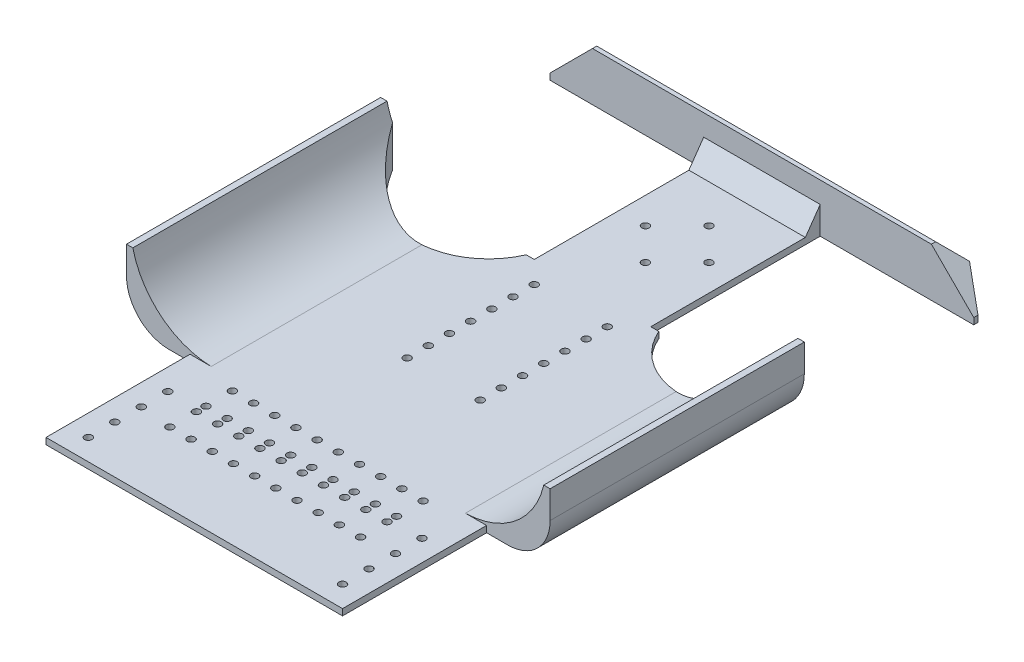
from build123d import *

# Parameters (mm, degrees)
BOSS_EXTRUDE1_DEPTH       = 3
BOSS_EXTRUDE2_DEPTH       = 20
CHAMFER1_SIZE             = 20
SKETCH9_R                 = 1.75
CUT_EXTRUDE6_DEPTH        = 192.426225998
CHAMFER2_SIZE             = 10
CHAMFER2_SIZE2            = 7.002075382
SKETCH12_W                = 40
SKETCH12_H                = 120
BOSS_EXTRUDE3_DEPTH       = 30
CUT_EXTRUDE8_DEPTH        = 120
CUT_EXTRUDE9_DEPTH        = 194.217494032
FILLET2_R                 = 20
SKETCH16_R                = 1.75
CUT_EXTRUDE10_DEPTH       = 193.727787374
LPATTERN1_COUNT           = 7
LPATTERN1_PITCH           = 10
SKETCH17_R                = 1.75
CUT_EXTRUDE11_DEPTH       = 193.727787374
LPATTERN2_COUNT           = 2
LPATTERN2_PITCH           = 12.5
MIRROR4_COPY_1_SKETCH_R   = 1.75
MIRROR4_COPY_1_DEPTH      = 193.727787374
SKETCH18_R                = 1.75
CUT_EXTRUDE12_DEPTH       = 193.727787374
LPATTERN3_COUNT           = 10
LPATTERN3_PITCH           = 10
LPATTERN4_COUNT           = 2
LPATTERN4_PITCH           = 12.5
LPATTERN4_COPY_1_SKETCH_R = 1.75
LPATTERN4_COPY_1_DEPTH    = 193.727787374
LPATTERN4_COPY_2_SKETCH_R = 1.75
LPATTERN4_COPY_2_DEPTH    = 193.727787374
LPATTERN4_COPY_3_SKETCH_R = 1.75
LPATTERN4_COPY_3_DEPTH    = 193.727787374
LPATTERN4_COPY_4_SKETCH_R = 1.75
LPATTERN4_COPY_4_DEPTH    = 193.727787374
LPATTERN4_COPY_5_SKETCH_R = 1.75
LPATTERN4_COPY_5_DEPTH    = 193.727787374
LPATTERN4_COPY_6_SKETCH_R = 1.75
LPATTERN4_COPY_6_DEPTH    = 193.727787374
LPATTERN4_COPY_7_SKETCH_R = 1.75
LPATTERN4_COPY_7_DEPTH    = 193.727787374
LPATTERN4_COPY_8_SKETCH_R = 1.75
LPATTERN4_COPY_8_DEPTH    = 193.727787374
LPATTERN4_COPY_9_SKETCH_R = 1.75
LPATTERN4_COPY_9_DEPTH    = 193.727787374


with BuildPart() as part:
    # Sketch1 → Boss-Extrude1 (new body)
    with BuildSketch(Plane(origin=(0, 0, 0), x_dir=(1, 0, 0), z_dir=(0, 1, 0))):
        Polygon((100, 60), (100, -60), (70, -60), (70, -128), (-70, -128), (-70, -60), (-100, -60), (-100, 60), (-27.5, 60), (-27.5, 140), (-100, 140), (-100, 142), (-70, 162), (70, 162), (100, 142), (100, 140), (27.5, 140), (27.5, 60), align=None)
    extrude(amount=BOSS_EXTRUDE1_DEPTH)

    # Sketch8 → Boss-Extrude2 (add)
    with BuildSketch(Plane(origin=(0, 3, 0), x_dir=(1, 0, 0), z_dir=(0, 1, 0))):
        Polygon((-100, 140), (100, 140), (100, 142), (70, 162), (-70, 162), (-100, 142), align=None)
    extrude(amount=BOSS_EXTRUDE2_DEPTH)

    # Chamfer1
    # the kernel refuses this chamfer: 20 mm, written as the material it takes off along each edge
    with BuildSketch(Plane(origin=(121.433659759, 23, -162), x_dir=(0, -0.9996219169112968, -0.027495876610586317), z_dir=(-1, 0, 0))) as chamfer1_piece_1:
        Polygon((CHAMFER1_SIZE * 0.999621916911, CHAMFER1_SIZE * 0.0274958766106), (-CHAMFER1_SIZE * 0.0274958766106, CHAMFER1_SIZE * 0.999621916911), (0, 0), align=None)
    extrude(amount=242.867319519, mode=Mode.SUBTRACT)
    with BuildSketch(Plane(origin=(-100, 23, -193.433659759), x_dir=(-0.027495876610586317, -0.9996219169112968, 0), z_dir=(0, 0, 1))) as chamfer1_piece_2:
        Polygon((CHAMFER1_SIZE * 0.999621916911, CHAMFER1_SIZE * 0.0274958766106), (-CHAMFER1_SIZE * 0.0274958766106, CHAMFER1_SIZE * 0.999621916911), (0, 0), align=None)
    extrude(amount=104.867319519, mode=Mode.SUBTRACT)
    with BuildSketch(Plane(origin=(100, 23, -88.566340241), x_dir=(-0.9996219169112968, 0.027495876610586317, 0), z_dir=(0, 0, -1))) as chamfer1_piece_3:
        Polygon((CHAMFER1_SIZE * 0.999621916911, -CHAMFER1_SIZE * 0.0274958766106), (-CHAMFER1_SIZE * 0.0274958766106, -CHAMFER1_SIZE * 0.999621916911), (0, 0), align=None)
    extrude(amount=104.867319519, mode=Mode.SUBTRACT)

    # Sketch9 → Cut-Extrude6 (cut, through all)
    with BuildSketch(Plane(origin=(0, 3, 0), x_dir=(1, 0, 0), z_dir=(0, 1, 0))):
        with Locations(Location((-15, 100, 0), (0, 0, 270))):
            Circle(SKETCH9_R)
        with Locations(Location((15, 100, 0), (0, 0, 270))):
            Circle(SKETCH9_R)
        with Locations(Location((0, 115, 0), (0, 0, 270))):
            Circle(SKETCH9_R)
        with Locations(Location((0, 85, 0), (0, 0, 270))):
            Circle(SKETCH9_R)
    extrude(amount=-CUT_EXTRUDE6_DEPTH, mode=Mode.SUBTRACT)

    # Chamfer2
    chamfer2_edges = [part.edges().sort_by_distance(p)[0] for p in [
        (0, 3, -140),
    ]]
    chamfer2_side = [part.faces().sort_by_distance(p)[0] for p in [
        (0, 11.429781082, -140),
    ]]
    chamfer(chamfer2_edges, length=CHAMFER2_SIZE, length2=CHAMFER2_SIZE2, reference=chamfer2_side[0])

    # Sketch12 → Boss-Extrude3 (add)
    with BuildSketch(Plane(origin=(0, 3, 0), x_dir=(1, 0, 0), z_dir=(0, 1, 0))):
        with Locations((-80, 0)):
            Rectangle(SKETCH12_W, SKETCH12_H)
    boss_extrude3 = extrude(amount=BOSS_EXTRUDE3_DEPTH)

    # Sketch13 → Cut-Extrude8 (cut)
    with BuildSketch(Plane.XY.offset(60)):
        with BuildLine():
            Line((-97, 33), (-60, 33))
            Line((-60, 33), (-60, 3))
            ThreePointArc((-60, 3), (-83.63033668, 11.672584761), (-97, 33))
        make_face()
    cut_extrude8 = extrude(amount=-CUT_EXTRUDE8_DEPTH, mode=Mode.SUBTRACT)

    # Sketch14 → Cut-Extrude9 (cut, through all)
    with BuildSketch(Plane.XZ):
        with BuildLine():
            Line((-31.303743975, -60), (-94.382349042, -60))
            ThreePointArc((-94.382349042, -60), (-62.843046509, -39.350555542), (-31.303743975, -60))
        make_face()
    cut_extrude9 = extrude(amount=-CUT_EXTRUDE9_DEPTH, mode=Mode.SUBTRACT)

    # Mirror3: Boss-Extrude3, Cut-Extrude8, Cut-Extrude9 across plane
    add(boss_extrude3.mirror(Plane(origin=(0, 0, 0), x_dir=(0, 0, 1), z_dir=(1, 0, 0))))
    add(cut_extrude8.mirror(Plane(origin=(0, 0, 0), x_dir=(0, 0, 1), z_dir=(1, 0, 0))), mode=Mode.SUBTRACT)
    add(cut_extrude9.mirror(Plane(origin=(0, 0, 0), x_dir=(0, 0, 1), z_dir=(1, 0, 0))), mode=Mode.SUBTRACT)

    # Fillet2
    fillet2_edges = [part.edges().sort_by_distance(p)[0] for p in [
        (-100, 0, 0),
        (100, 0, 0),
    ]]
    fillet(fillet2_edges, radius=FILLET2_R)

    # Sketch16 → Cut-Extrude10 (cut, through all)
    with BuildSketch(Plane(origin=(0, 3, 0), x_dir=(1, 0, 0), z_dir=(0, 1, 0))):
        with Locations(Location((-17.25, 49.727630158, 0), (0, 0, 270))):
            Circle(SKETCH16_R)
        with Locations(Location((17.25, 49.727630158, 0), (0, 0, 270))):
            Circle(SKETCH16_R)
    cut_extrude10 = extrude(amount=-CUT_EXTRUDE10_DEPTH, mode=Mode.SUBTRACT)

    # LPattern1: Cut-Extrude10 ×7
    with Locations(*[(0, 0, i * LPATTERN1_PITCH) for i in range(1, LPATTERN1_COUNT)]):
        add(cut_extrude10, mode=Mode.SUBTRACT)

    # Sketch17 → Cut-Extrude11 (cut, through all)
    with BuildSketch(Plane(origin=(0, 3, 0), x_dir=(1, 0, 0), z_dir=(0, 1, 0))):
        with Locations(Location((-60, -118, 0), (0, 0, 270))):
            Circle(SKETCH17_R)
        with Locations(Location((-60, -93, 0), (0, 0, 270))):
            Circle(SKETCH17_R)
    cut_extrude11 = extrude(amount=-CUT_EXTRUDE11_DEPTH, mode=Mode.SUBTRACT)

    # LPattern2: Cut-Extrude11 ×2
    with Locations(*[(0, 0, -i * LPATTERN2_PITCH) for i in range(1, LPATTERN2_COUNT)]):
        add(cut_extrude11, mode=Mode.SUBTRACT)

    # Mirror4: Cut-Extrude11 across plane
    add(cut_extrude11.mirror(Plane(origin=(0, 0, 0), x_dir=(0, 0, 1), z_dir=(1, 0, 0))), mode=Mode.SUBTRACT)

    # Mirror4 copy 1 sketch → Mirror4 copy 1 (cut, through all)
    with BuildSketch(Plane(origin=(0, 3, -12.5), x_dir=(-1, 0, 0), z_dir=(0, 1, 0))):
        with Locations((-60, 118)):
            Circle(MIRROR4_COPY_1_SKETCH_R)
        with Locations((-60, 93)):
            Circle(MIRROR4_COPY_1_SKETCH_R)
    extrude(amount=-MIRROR4_COPY_1_DEPTH, mode=Mode.SUBTRACT)

    # Sketch18 → Cut-Extrude12 (cut, through all)
    with BuildSketch(Plane(origin=(0, 3, 0), x_dir=(1, 0, 0), z_dir=(0, 1, 0))):
        with Locations(Location((-45, -82, 0), (0, 0, 270))):
            Circle(SKETCH18_R)
        with Locations(Location((-45, -65, 0), (0, 0, 270))):
            Circle(SKETCH18_R)
    cut_extrude12 = extrude(amount=-CUT_EXTRUDE12_DEPTH, mode=Mode.SUBTRACT)

    # LPattern3: Cut-Extrude12 ×10
    with Locations(*[(i * LPATTERN3_PITCH, 0, 0) for i in range(1, LPATTERN3_COUNT)]):
        add(cut_extrude12, mode=Mode.SUBTRACT)

    # LPattern4: Cut-Extrude12 ×2
    with Locations(*[(0, 0, i * LPATTERN4_PITCH) for i in range(1, LPATTERN4_COUNT)]):
        add(cut_extrude12, mode=Mode.SUBTRACT)

    # LPattern4 copy 1 sketch → LPattern4 copy 1 (cut, through all)
    with BuildSketch(Plane(origin=(10, 3, 12.5), x_dir=(1, 0, 0), z_dir=(0, 1, 0))):
        with Locations(Location((-45, -82, 0), (0, 0, 270))):
            Circle(LPATTERN4_COPY_1_SKETCH_R)
        with Locations(Location((-45, -65, 0), (0, 0, 270))):
            Circle(LPATTERN4_COPY_1_SKETCH_R)
    extrude(amount=-LPATTERN4_COPY_1_DEPTH, mode=Mode.SUBTRACT)

    # LPattern4 copy 2 sketch → LPattern4 copy 2 (cut, through all)
    with BuildSketch(Plane(origin=(20, 3, 12.5), x_dir=(1, 0, 0), z_dir=(0, 1, 0))):
        with Locations(Location((-45, -82, 0), (0, 0, 270))):
            Circle(LPATTERN4_COPY_2_SKETCH_R)
        with Locations(Location((-45, -65, 0), (0, 0, 270))):
            Circle(LPATTERN4_COPY_2_SKETCH_R)
    extrude(amount=-LPATTERN4_COPY_2_DEPTH, mode=Mode.SUBTRACT)

    # LPattern4 copy 3 sketch → LPattern4 copy 3 (cut, through all)
    with BuildSketch(Plane(origin=(30, 3, 12.5), x_dir=(1, 0, 0), z_dir=(0, 1, 0))):
        with Locations(Location((-45, -82, 0), (0, 0, 270))):
            Circle(LPATTERN4_COPY_3_SKETCH_R)
        with Locations(Location((-45, -65, 0), (0, 0, 270))):
            Circle(LPATTERN4_COPY_3_SKETCH_R)
    extrude(amount=-LPATTERN4_COPY_3_DEPTH, mode=Mode.SUBTRACT)

    # LPattern4 copy 4 sketch → LPattern4 copy 4 (cut, through all)
    with BuildSketch(Plane(origin=(40, 3, 12.5), x_dir=(1, 0, 0), z_dir=(0, 1, 0))):
        with Locations(Location((-45, -82, 0), (0, 0, 270))):
            Circle(LPATTERN4_COPY_4_SKETCH_R)
        with Locations(Location((-45, -65, 0), (0, 0, 270))):
            Circle(LPATTERN4_COPY_4_SKETCH_R)
    extrude(amount=-LPATTERN4_COPY_4_DEPTH, mode=Mode.SUBTRACT)

    # LPattern4 copy 5 sketch → LPattern4 copy 5 (cut, through all)
    with BuildSketch(Plane(origin=(50, 3, 12.5), x_dir=(1, 0, 0), z_dir=(0, 1, 0))):
        with Locations(Location((-45, -82, 0), (0, 0, 270))):
            Circle(LPATTERN4_COPY_5_SKETCH_R)
        with Locations(Location((-45, -65, 0), (0, 0, 270))):
            Circle(LPATTERN4_COPY_5_SKETCH_R)
    extrude(amount=-LPATTERN4_COPY_5_DEPTH, mode=Mode.SUBTRACT)

    # LPattern4 copy 6 sketch → LPattern4 copy 6 (cut, through all)
    with BuildSketch(Plane(origin=(60, 3, 12.5), x_dir=(1, 0, 0), z_dir=(0, 1, 0))):
        with Locations(Location((-45, -82, 0), (0, 0, 270))):
            Circle(LPATTERN4_COPY_6_SKETCH_R)
        with Locations(Location((-45, -65, 0), (0, 0, 270))):
            Circle(LPATTERN4_COPY_6_SKETCH_R)
    extrude(amount=-LPATTERN4_COPY_6_DEPTH, mode=Mode.SUBTRACT)

    # LPattern4 copy 7 sketch → LPattern4 copy 7 (cut, through all)
    with BuildSketch(Plane(origin=(70, 3, 12.5), x_dir=(1, 0, 0), z_dir=(0, 1, 0))):
        with Locations(Location((-45, -82, 0), (0, 0, 270))):
            Circle(LPATTERN4_COPY_7_SKETCH_R)
        with Locations(Location((-45, -65, 0), (0, 0, 270))):
            Circle(LPATTERN4_COPY_7_SKETCH_R)
    extrude(amount=-LPATTERN4_COPY_7_DEPTH, mode=Mode.SUBTRACT)

    # LPattern4 copy 8 sketch → LPattern4 copy 8 (cut, through all)
    with BuildSketch(Plane(origin=(80, 3, 12.5), x_dir=(1, 0, 0), z_dir=(0, 1, 0))):
        with Locations(Location((-45, -82, 0), (0, 0, 270))):
            Circle(LPATTERN4_COPY_8_SKETCH_R)
        with Locations(Location((-45, -65, 0), (0, 0, 270))):
            Circle(LPATTERN4_COPY_8_SKETCH_R)
    extrude(amount=-LPATTERN4_COPY_8_DEPTH, mode=Mode.SUBTRACT)

    # LPattern4 copy 9 sketch → LPattern4 copy 9 (cut, through all)
    with BuildSketch(Plane(origin=(90, 3, 12.5), x_dir=(1, 0, 0), z_dir=(0, 1, 0))):
        with Locations(Location((-45, -82, 0), (0, 0, 270))):
            Circle(LPATTERN4_COPY_9_SKETCH_R)
        with Locations(Location((-45, -65, 0), (0, 0, 270))):
            Circle(LPATTERN4_COPY_9_SKETCH_R)
    extrude(amount=-LPATTERN4_COPY_9_DEPTH, mode=Mode.SUBTRACT)


solid = part.part
